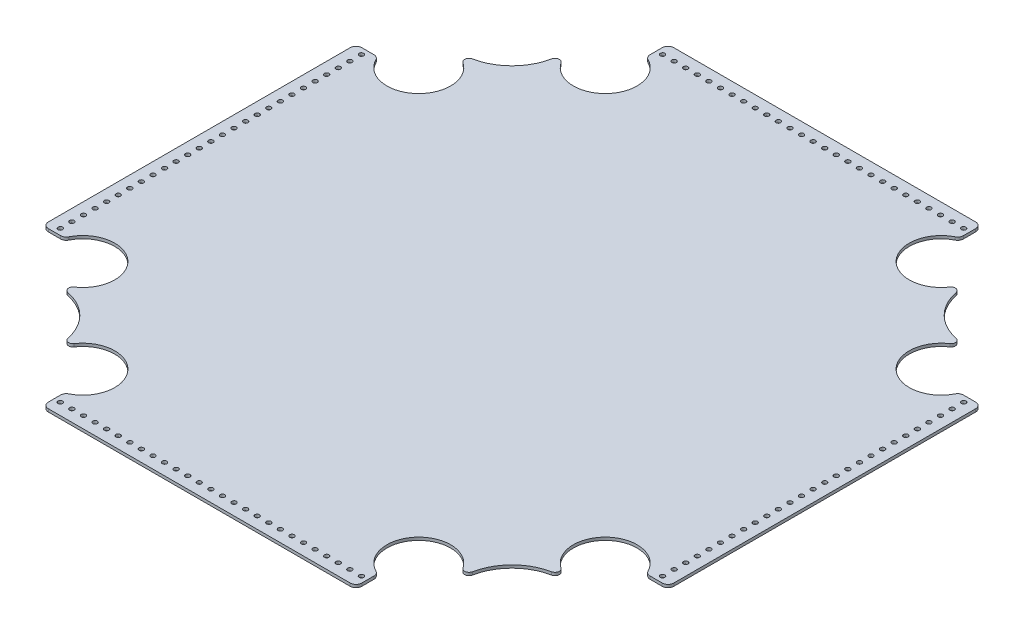
from build123d import *

# Parameters (mm, degrees)
SKETCH1_W           = 685.8
SKETCH1_H           = 685.8
BOSS_EXTRUDE1_DEPTH = 3.175
CUT_EXTRUDE2_DEPTH  = 3.175
SKETCH2_R           = 2.4892
CUT_EXTRUDE1_DEPTH  = 3.175
FILLET1_R           = 6.35


with BuildPart() as part:
    # Sketch1 → Boss-Extrude1 (new body)
    with BuildSketch(Plane(origin=(0, 0, 0), x_dir=(1, 0, 0), z_dir=(0, 1, 0))):
        Rectangle(SKETCH1_W, SKETCH1_H)
    extrude(amount=BOSS_EXTRUDE1_DEPTH)

    # Sketch3 → Cut-Extrude2 (cut)
    with BuildSketch(Plane(origin=(0, 3.175, 0), x_dir=(1, 0, 0), z_dir=(0, 1, 0))):
        with BuildLine():
            Line((-171.831, 319.065236596), (-171.831, 342.9))
            Line((-171.831, 342.9), (-342.9, 342.9))
            Line((-342.9, 342.9), (-342.9, 171.831))
            Line((-342.9, 171.831), (-319.065236596, 171.831))
            ThreePointArc((-319.065236596, 171.831), (-264.697833655, 156.774418893), (-266.915318507, 213.144605146))
            ThreePointArc((-266.915318507, 213.144605146), (-268.931826313, 218.025144056), (-265.204938628, 221.766303232))
            ThreePointArc((-265.204938628, 221.766303232), (-236.93637947, 236.93637947), (-221.766303232, 265.204938628))
            ThreePointArc((-221.766303232, 265.204938628), (-218.025144056, 268.931826313), (-213.144605146, 266.915318507))
            ThreePointArc((-213.144605146, 266.915318507), (-156.774418893, 264.697833655), (-171.831, 319.065236596))
        make_face()
        with BuildLine():
            Line((342.9, 342.9), (171.831, 342.9))
            Line((171.831, 342.9), (171.831, 319.065236596))
            ThreePointArc((171.831, 319.065236596), (156.774418893, 264.697833655), (213.144605146, 266.915318507))
            ThreePointArc((213.144605146, 266.915318507), (218.025144056, 268.931826313), (221.766303232, 265.204938628))
            ThreePointArc((221.766303232, 265.204938628), (236.93637947, 236.93637947), (265.204938628, 221.766303232))
            ThreePointArc((265.204938628, 221.766303232), (268.931826313, 218.025144056), (266.915318507, 213.144605146))
            ThreePointArc((266.915318507, 213.144605146), (264.697833655, 156.774418893), (319.065236596, 171.831))
            Line((319.065236596, 171.831), (342.9, 171.831))
            Line((342.9, 171.831), (342.9, 342.9))
        make_face()
        with BuildLine():
            Line((171.831, -319.065236596), (171.831, -342.9))
            Line((171.831, -342.9), (342.9, -342.9))
            Line((342.9, -342.9), (342.9, -171.831))
            Line((342.9, -171.831), (319.065236596, -171.831))
            ThreePointArc((319.065236596, -171.831), (264.697833655, -156.774418893), (266.915318507, -213.144605146))
            ThreePointArc((266.915318507, -213.144605146), (268.931826313, -218.025144056), (265.204938628, -221.766303232))
            ThreePointArc((265.204938628, -221.766303232), (236.93637947, -236.93637947), (221.766303232, -265.204938628))
            ThreePointArc((221.766303232, -265.204938628), (218.025144056, -268.931826313), (213.144605146, -266.915318507))
            ThreePointArc((213.144605146, -266.915318507), (156.774418893, -264.697833655), (171.831, -319.065236596))
        make_face()
        with BuildLine():
            Line((-342.9, -342.9), (-171.831, -342.9))
            Line((-171.831, -342.9), (-171.831, -319.065236596))
            ThreePointArc((-171.831, -319.065236596), (-156.774418893, -264.697833655), (-213.144605146, -266.915318507))
            ThreePointArc((-213.144605146, -266.915318507), (-218.025144056, -268.931826313), (-221.766303232, -265.204938628))
            ThreePointArc((-221.766303232, -265.204938628), (-236.93637947, -236.93637947), (-265.204938628, -221.766303232))
            ThreePointArc((-265.204938628, -221.766303232), (-268.931826313, -218.025144056), (-266.915318507, -213.144605146))
            ThreePointArc((-266.915318507, -213.144605146), (-264.697833655, -156.774418893), (-319.065236596, -171.831))
            Line((-319.065236596, -171.831), (-342.9, -171.831))
            Line((-342.9, -171.831), (-342.9, -342.9))
        make_face()
    extrude(amount=-CUT_EXTRUDE2_DEPTH, mode=Mode.SUBTRACT)

    # Sketch2 → Cut-Extrude1 (cut)
    with BuildSketch(Plane(origin=(0, 3.175, 0), x_dir=(1, 0, 0), z_dir=(0, 1, 0))):
        with Locations((165.1, 330.2)):
            Circle(SKETCH2_R)
        with Locations((152.4, 330.2)):
            Circle(SKETCH2_R)
        with Locations((139.7, 330.2)):
            Circle(SKETCH2_R)
        with Locations((127, 330.2)):
            Circle(SKETCH2_R)
        with Locations((114.3, 330.2)):
            Circle(SKETCH2_R)
        with Locations((101.6, 330.2)):
            Circle(SKETCH2_R)
        with Locations((88.9, 330.2)):
            Circle(SKETCH2_R)
        with Locations((76.2, 330.2)):
            Circle(SKETCH2_R)
        with Locations((63.5, 330.2)):
            Circle(SKETCH2_R)
        with Locations((50.8, 330.2)):
            Circle(SKETCH2_R)
        with Locations((38.1, 330.2)):
            Circle(SKETCH2_R)
        with Locations((25.4, 330.2)):
            Circle(SKETCH2_R)
        with Locations((12.7, 330.2)):
            Circle(SKETCH2_R)
        with Locations((0, 330.2)):
            Circle(SKETCH2_R)
        with Locations((-12.7, 330.2)):
            Circle(SKETCH2_R)
        with Locations((-25.4, 330.2)):
            Circle(SKETCH2_R)
        with Locations((-38.1, 330.2)):
            Circle(SKETCH2_R)
        with Locations((-50.8, 330.2)):
            Circle(SKETCH2_R)
        with Locations((-63.5, 330.2)):
            Circle(SKETCH2_R)
        with Locations((-76.2, 330.2)):
            Circle(SKETCH2_R)
        with Locations((-88.9, 330.2)):
            Circle(SKETCH2_R)
        with Locations((-101.6, 330.2)):
            Circle(SKETCH2_R)
        with Locations((-114.3, 330.2)):
            Circle(SKETCH2_R)
        with Locations((-127, 330.2)):
            Circle(SKETCH2_R)
        with Locations((-139.7, 330.2)):
            Circle(SKETCH2_R)
        with Locations((-152.4, 330.2)):
            Circle(SKETCH2_R)
        with Locations((-165.1, 330.2)):
            Circle(SKETCH2_R)
        with Locations((-330.2, 165.1)):
            Circle(SKETCH2_R)
        with Locations((-330.2, 152.4)):
            Circle(SKETCH2_R)
        with Locations((-330.2, 139.7)):
            Circle(SKETCH2_R)
        with Locations((-330.2, 127)):
            Circle(SKETCH2_R)
        with Locations((-330.2, 114.3)):
            Circle(SKETCH2_R)
        with Locations((-330.2, 101.6)):
            Circle(SKETCH2_R)
        with Locations((-330.2, 88.9)):
            Circle(SKETCH2_R)
        with Locations((-330.2, 76.2)):
            Circle(SKETCH2_R)
        with Locations((-330.2, 63.5)):
            Circle(SKETCH2_R)
        with Locations((-330.2, 50.8)):
            Circle(SKETCH2_R)
        with Locations((-330.2, 38.1)):
            Circle(SKETCH2_R)
        with Locations((-330.2, 25.4)):
            Circle(SKETCH2_R)
        with Locations((-330.2, 12.7)):
            Circle(SKETCH2_R)
        with Locations((-330.2, 0)):
            Circle(SKETCH2_R)
        with Locations((-330.2, -12.7)):
            Circle(SKETCH2_R)
        with Locations((-330.2, -25.4)):
            Circle(SKETCH2_R)
        with Locations((-330.2, -38.1)):
            Circle(SKETCH2_R)
        with Locations((-330.2, -50.8)):
            Circle(SKETCH2_R)
        with Locations((-330.2, -63.5)):
            Circle(SKETCH2_R)
        with Locations((-330.2, -76.2)):
            Circle(SKETCH2_R)
        with Locations((-330.2, -88.9)):
            Circle(SKETCH2_R)
        with Locations((-330.2, -101.6)):
            Circle(SKETCH2_R)
        with Locations((-330.2, -114.3)):
            Circle(SKETCH2_R)
        with Locations((-330.2, -127)):
            Circle(SKETCH2_R)
        with Locations((-330.2, -139.7)):
            Circle(SKETCH2_R)
        with Locations((-330.2, -152.4)):
            Circle(SKETCH2_R)
        with Locations((-330.2, -165.1)):
            Circle(SKETCH2_R)
        with Locations((-165.1, -330.2)):
            Circle(SKETCH2_R)
        with Locations((-152.4, -330.2)):
            Circle(SKETCH2_R)
        with Locations((-139.7, -330.2)):
            Circle(SKETCH2_R)
        with Locations((-127, -330.2)):
            Circle(SKETCH2_R)
        with Locations((-114.3, -330.2)):
            Circle(SKETCH2_R)
        with Locations((-101.6, -330.2)):
            Circle(SKETCH2_R)
        with Locations((-88.9, -330.2)):
            Circle(SKETCH2_R)
        with Locations((-76.2, -330.2)):
            Circle(SKETCH2_R)
        with Locations((-63.5, -330.2)):
            Circle(SKETCH2_R)
        with Locations((-50.8, -330.2)):
            Circle(SKETCH2_R)
        with Locations((-38.1, -330.2)):
            Circle(SKETCH2_R)
        with Locations((-25.4, -330.2)):
            Circle(SKETCH2_R)
        with Locations((-12.7, -330.2)):
            Circle(SKETCH2_R)
        with Locations((0, -330.2)):
            Circle(SKETCH2_R)
        with Locations((12.7, -330.2)):
            Circle(SKETCH2_R)
        with Locations((25.4, -330.2)):
            Circle(SKETCH2_R)
        with Locations((38.1, -330.2)):
            Circle(SKETCH2_R)
        with Locations((50.8, -330.2)):
            Circle(SKETCH2_R)
        with Locations((63.5, -330.2)):
            Circle(SKETCH2_R)
        with Locations((76.2, -330.2)):
            Circle(SKETCH2_R)
        with Locations((88.9, -330.2)):
            Circle(SKETCH2_R)
        with Locations((101.6, -330.2)):
            Circle(SKETCH2_R)
        with Locations((114.3, -330.2)):
            Circle(SKETCH2_R)
        with Locations((127, -330.2)):
            Circle(SKETCH2_R)
        with Locations((139.7, -330.2)):
            Circle(SKETCH2_R)
        with Locations((152.4, -330.2)):
            Circle(SKETCH2_R)
        with Locations((165.1, -330.2)):
            Circle(SKETCH2_R)
        with Locations((330.2, -165.1)):
            Circle(SKETCH2_R)
        with Locations((330.2, -152.4)):
            Circle(SKETCH2_R)
        with Locations((330.2, -139.7)):
            Circle(SKETCH2_R)
        with Locations((330.2, -127)):
            Circle(SKETCH2_R)
        with Locations((330.2, -114.3)):
            Circle(SKETCH2_R)
        with Locations((330.2, -101.6)):
            Circle(SKETCH2_R)
        with Locations((330.2, -88.9)):
            Circle(SKETCH2_R)
        with Locations((330.2, -76.2)):
            Circle(SKETCH2_R)
        with Locations((330.2, -63.5)):
            Circle(SKETCH2_R)
        with Locations((330.2, -50.8)):
            Circle(SKETCH2_R)
        with Locations((330.2, -38.1)):
            Circle(SKETCH2_R)
        with Locations((330.2, -25.4)):
            Circle(SKETCH2_R)
        with Locations((330.2, -12.7)):
            Circle(SKETCH2_R)
        with Locations((330.2, 0)):
            Circle(SKETCH2_R)
        with Locations((330.2, 12.7)):
            Circle(SKETCH2_R)
        with Locations((330.2, 25.4)):
            Circle(SKETCH2_R)
        with Locations((330.2, 38.1)):
            Circle(SKETCH2_R)
        with Locations((330.2, 50.8)):
            Circle(SKETCH2_R)
        with Locations((330.2, 63.5)):
            Circle(SKETCH2_R)
        with Locations((330.2, 76.2)):
            Circle(SKETCH2_R)
        with Locations((330.2, 88.9)):
            Circle(SKETCH2_R)
        with Locations((330.2, 101.6)):
            Circle(SKETCH2_R)
        with Locations((330.2, 114.3)):
            Circle(SKETCH2_R)
        with Locations((330.2, 127)):
            Circle(SKETCH2_R)
        with Locations((330.2, 139.7)):
            Circle(SKETCH2_R)
        with Locations((330.2, 152.4)):
            Circle(SKETCH2_R)
        with Locations((330.2, 165.1)):
            Circle(SKETCH2_R)
    extrude(amount=-CUT_EXTRUDE1_DEPTH, mode=Mode.SUBTRACT)

    # Fillet1
    fillet1_edges = [part.edges().sort_by_distance(p)[0] for p in [
        (-171.831, 1.5875, 342.9),
        (171.831, 1.5875, 342.9),
        (171.831, 1.5875, 319.065236596),
        (319.065236596, 1.5875, 171.831),
        (342.9, 1.5875, 171.831),
        (342.9, 1.5875, -171.831),
        (319.065236596, 1.5875, -171.831),
        (171.831, 1.5875, -319.065236596),
        (171.831, 1.5875, -342.9),
        (-171.831, 1.5875, -319.065236596),
        (-319.065236596, 1.5875, -171.831),
        (-342.9, 1.5875, -171.831),
        (-342.9, 1.5875, 171.831),
        (-319.065236596, 1.5875, 171.831),
        (-171.831, 1.5875, 319.065236596),
        (-171.831, 1.5875, -342.9),
    ]]
    fillet(fillet1_edges, radius=FILLET1_R)


solid = part.part
